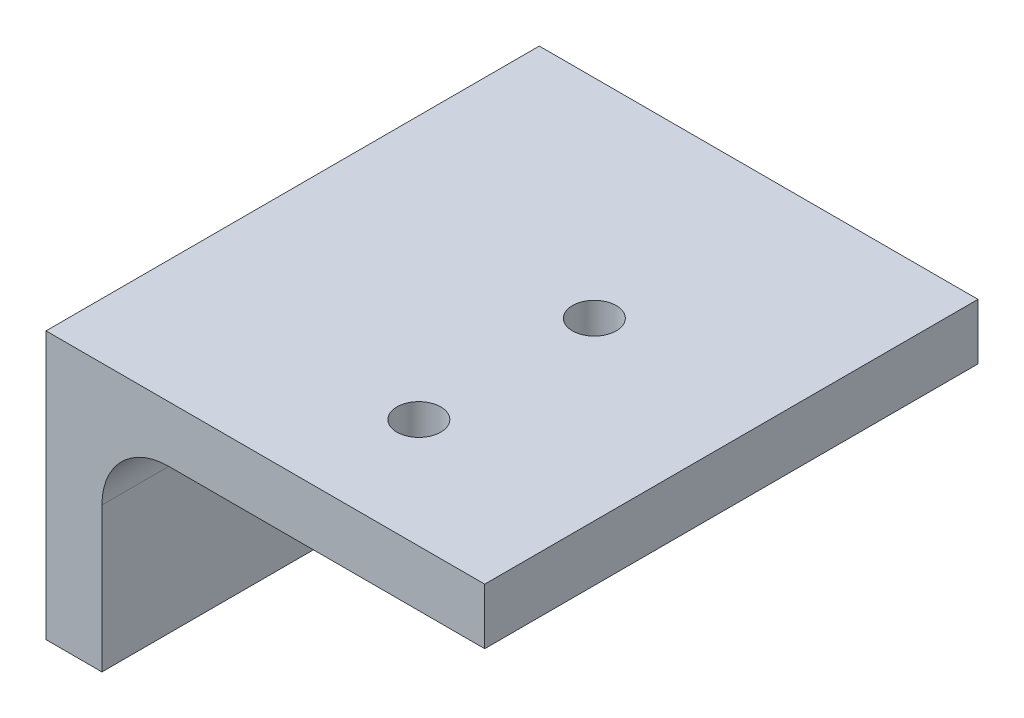
from build123d import *

# Parameters (mm, degrees)
BOSS_EXTRUDE1_DEPTH = 56.22
SKETCH2_R           = 2.5
CUT_EXTRUDE1_DEPTH  = 115.793413139
SKETCH4_R           = 2.5
CUT_EXTRUDE2_DEPTH  = 84.79035028


with BuildPart() as part:
    # Sketch1 → Boss-Extrude1 (new body)
    with BuildSketch(Plane.XY):
        with BuildLine():
            Line((45.33, -6.4), (45.33, -36.88))
            Line((45.33, -36.88), (51.7054, -36.88))
            Line((51.7054, -36.88), (51.7054, -20.3954))
            ThreePointArc((51.7054, -20.3954), (53.937246327, -15.007246327), (59.3254, -12.7754))
            Line((59.3254, -12.7754), (95.33, -12.7754))
            Line((95.33, -12.7754), (95.33, -6.4))
            Line((95.33, -6.4), (45.33, -6.4))
        make_face()
    extrude(amount=-BOSS_EXTRUDE1_DEPTH)

    # Sketch2 → Cut-Extrude1 (cut, through all)
    with BuildSketch(Plane(origin=(0, -6.4, 0), x_dir=(1, 0, 0), z_dir=(0, 1, 0))):
        with Locations((75.33, 12.493588432)):
            Circle(SKETCH2_R)
        with Locations((75.33, 32.493588432)):
            Circle(SKETCH2_R)
    extrude(amount=-CUT_EXTRUDE1_DEPTH, mode=Mode.SUBTRACT)

    # Sketch4 → Cut-Extrude2 (cut, through all)
    with BuildSketch(Plane.ZY.offset(-45.33)):
        with Locations((-32.598, -24.18)):
            Circle(SKETCH4_R)
    extrude(amount=-CUT_EXTRUDE2_DEPTH, mode=Mode.SUBTRACT)


solid = part.part
